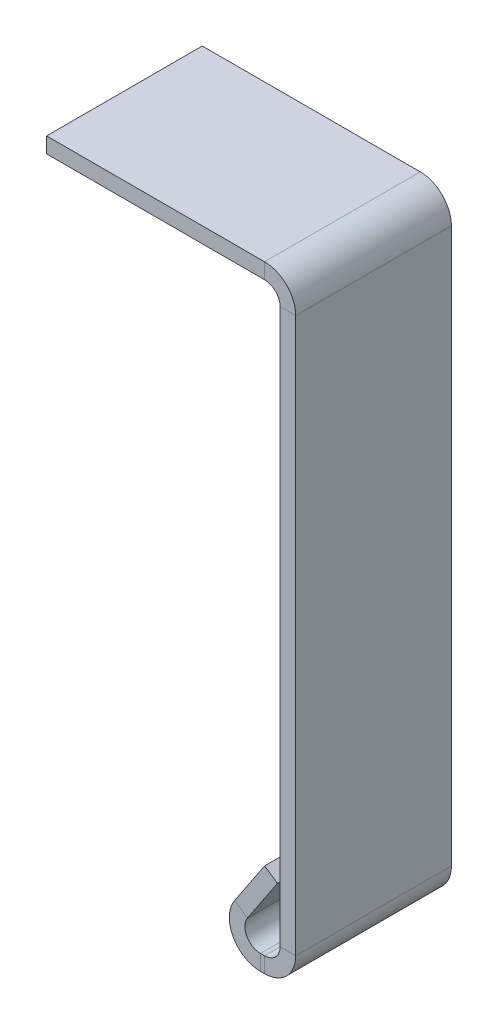
from build123d import *

# Parameters (mm, degrees)
BASE_FLANGE1_DEPTH = 2.5


# Sheet-metal steps are written as plain solids
with BuildPart() as part:
    # Sketch1 → Base-Flange1 (new, symmetric)
    with BuildSketch(Plane.XY):
        with BuildLine():
            Line((-8, 19.8), (-1, 19.8))
            ThreePointArc((-1, 19.8), (-0.292893219, 19.507106781), (0, 18.8))
            Line((0, 18.8), (0, 1))
            ThreePointArc((0, 1), (-0.292893219, 0.292893219), (-1, 0))
            Line((-1, 0), (-1.131482908, 0))
            ThreePointArc((-1.131482908, 0), (-2.013157507, 0.528142074), (-1.963533203, 1.554700196))
            Line((-1.963533203, 1.554700196), (-1, 3))
            Line((-1, 3), (-0.583974853, 2.722649902))
            Line((-0.583974853, 2.722649902), (-1.547508055, 1.277350098))
            ThreePointArc((-1.547508055, 1.277350098), (-1.572320208, 0.764071037), (-1.131482908, 0.5))
            Line((-1.131482908, 0.5), (-1, 0.5))
            ThreePointArc((-1, 0.5), (-0.646446609, 0.646446609), (-0.5, 1))
            Line((-0.5, 1), (-0.5, 18.8))
            ThreePointArc((-0.5, 18.8), (-0.646446609, 19.153553391), (-1, 19.3))
            Line((-1, 19.3), (-8, 19.3))
            Line((-8, 19.3), (-8, 19.8))
        make_face()
    extrude(amount=BASE_FLANGE1_DEPTH, both=True)


solid = part.part
